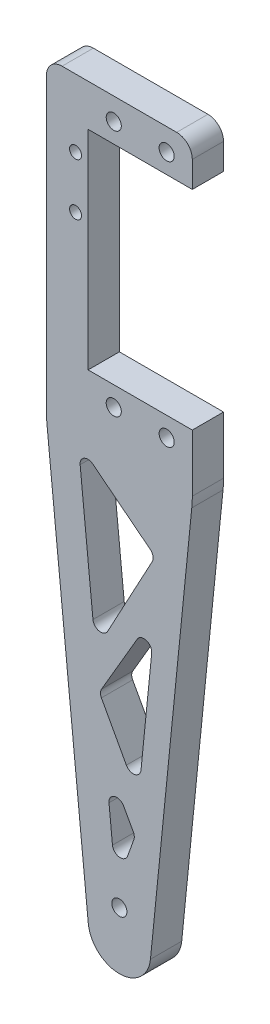
from build123d import *

# Parameters (mm, degrees)
BOSS_EXTRU_1_DEPTH      = 6
CONG_1_R                = 3
CONG_2_R                = 20
ENL_V_MAT_EXTRU_1_REACH = 118.402
ESQUISSE2_R             = 1.45
ENL_V_MAT_EXTRU_2_REACH = 118.402
CONG_3_R                = 1.5
ESQUISSE4_R             = 1.45
ENL_V_MAT_EXTRU_3_DEPTH = 6
ESQUISSE5_R             = 1.15
ENL_V_MAT_EXTRU_4_DEPTH = 6


with BuildPart() as part:
    # Esquisse1 → Boss.-Extru.1 (new body)
    with BuildSketch(Plane.XY):
        with BuildLine():
            Line((-14, -30), (-5.970001079, -110))
            ThreePointArc((-5.970001079, -110), (0, -115.400761222), (5.970001079, -110))
            Line((5.970001079, -110), (14, -30))
            Line((14, -30), (14, -18))
            Line((14, -18), (-6, -18))
            Line((-6, -18), (-6, 22))
            Line((-6, 22), (14, 22))
            Line((14, 22), (14, 30))
            Line((14, 30), (-14, 30))
            Line((-14, 30), (-14, -30))
        make_face()
    extrude(amount=BOSS_EXTRU_1_DEPTH)

    # Congé1
    cong_1_edges = [part.edges().sort_by_distance(p)[0] for p in [
        (-14, 30, 3),
        (14, 30, 3),
    ]]
    fillet(cong_1_edges, radius=CONG_1_R)

    # Congé2
    cong_2_edges = [part.edges().sort_by_distance(p)[0] for p in [
        (14, -30, 3),
        (-14, -30, 3),
    ]]
    fillet(cong_2_edges, radius=CONG_2_R)

    # Esquisse2 → Enlèv. mat.-Extru.1 (cut, up to next)
    with BuildSketch(Plane.XY.offset(6), mode=Mode.PRIVATE) as enl_v_mat_extru_1_sk1:
        with Locations((9.08, -21.75)):
            Circle(ESQUISSE2_R)
    enl_v_mat_extru_1_tool1 = extrude(enl_v_mat_extru_1_sk1.sketch, amount=-ENL_V_MAT_EXTRU_1_REACH, mode=Mode.PRIVATE) & part.part
    # Esquisse2 → Enlèv. mat.-Extru.1 (cut, up to next)
    with BuildSketch(Plane.XY.offset(6), mode=Mode.PRIVATE) as enl_v_mat_extru_1_sk2:
        with Locations((-1.08, -21.75)):
            Circle(ESQUISSE2_R)
    enl_v_mat_extru_1_tool2 = extrude(enl_v_mat_extru_1_sk2.sketch, amount=-ENL_V_MAT_EXTRU_1_REACH, mode=Mode.PRIVATE) & part.part
    # Esquisse2 → Enlèv. mat.-Extru.1 (cut, up to next)
    with BuildSketch(Plane.XY.offset(6), mode=Mode.PRIVATE) as enl_v_mat_extru_1_sk3:
        with Locations((-1.08, 25.75)):
            Circle(ESQUISSE2_R)
    enl_v_mat_extru_1_tool3 = extrude(enl_v_mat_extru_1_sk3.sketch, amount=-ENL_V_MAT_EXTRU_1_REACH, mode=Mode.PRIVATE) & part.part
    # Esquisse2 → Enlèv. mat.-Extru.1 (cut, up to next)
    with BuildSketch(Plane.XY.offset(6), mode=Mode.PRIVATE) as enl_v_mat_extru_1_sk4:
        with Locations((9.08, 25.75)):
            Circle(ESQUISSE2_R)
    enl_v_mat_extru_1_tool4 = extrude(enl_v_mat_extru_1_sk4.sketch, amount=-ENL_V_MAT_EXTRU_1_REACH, mode=Mode.PRIVATE) & part.part
    add(enl_v_mat_extru_1_tool1.solids().sort_by_distance((9.08, -21.75, 6))[0], mode=Mode.SUBTRACT)
    add(enl_v_mat_extru_1_tool2.solids().sort_by_distance((-1.08, -21.75, 6))[0], mode=Mode.SUBTRACT)
    add(enl_v_mat_extru_1_tool3.solids().sort_by_distance((-1.08, 25.75, 6))[0], mode=Mode.SUBTRACT)
    add(enl_v_mat_extru_1_tool4.solids().sort_by_distance((9.08, 25.75, 6))[0], mode=Mode.SUBTRACT)

    # Esquisse3 → Enlèv. mat.-Extru.2 (cut, up to next)
    with BuildSketch(Plane.XY.offset(6), mode=Mode.PRIVATE) as enl_v_mat_extru_2_sk1:
        Polygon((-7.886583597, -31.017533633), (-4.584381628, -63.916187805), (6.894740823, -42.63737417), align=None)
    enl_v_mat_extru_2_tool1 = extrude(enl_v_mat_extru_2_sk1.sketch, amount=-ENL_V_MAT_EXTRU_2_REACH, mode=Mode.PRIVATE) & part.part
    # Esquisse3 → Enlèv. mat.-Extru.2 (cut, up to next)
    with BuildSketch(Plane.XY.offset(6), mode=Mode.PRIVATE) as enl_v_mat_extru_2_sk2:
        Polygon((6.894740823, -52.121802831), (-3.854189345, -70.511493223), (3.66385974, -84.30991259), align=None)
    enl_v_mat_extru_2_tool2 = extrude(enl_v_mat_extru_2_sk2.sketch, amount=-ENL_V_MAT_EXTRU_2_REACH, mode=Mode.PRIVATE) & part.part
    # Esquisse3 → Enlèv. mat.-Extru.2 (cut, up to next)
    with BuildSketch(Plane.XY.offset(6), mode=Mode.PRIVATE) as enl_v_mat_extru_2_sk3:
        Polygon((-2.728137467, -80.682315655), (-0.663223344, -101.254314661), (3.006387716, -91.078168987), align=None)
    enl_v_mat_extru_2_tool3 = extrude(enl_v_mat_extru_2_sk3.sketch, amount=-ENL_V_MAT_EXTRU_2_REACH, mode=Mode.PRIVATE) & part.part
    add(enl_v_mat_extru_2_tool1.solids().sort_by_distance((-1.858741, -45.857032, 6))[0], mode=Mode.SUBTRACT)
    add(enl_v_mat_extru_2_tool2.solids().sort_by_distance((2.234804, -68.98107, 6))[0], mode=Mode.SUBTRACT)
    add(enl_v_mat_extru_2_tool3.solids().sort_by_distance((-0.128324, -91.004933, 6))[0], mode=Mode.SUBTRACT)

    # Congé3
    cong_3_edges = [part.edges().sort_by_distance(p)[0] for p in [
        (6.894740823, -42.63737417, 3),
        (-4.584381628, -63.916187805, 3),
        (-7.886583597, -31.017533633, 3),
        (3.006387716, -91.078168987, 3),
        (-2.728137467, -80.682315655, 3),
        (-0.663223344, -101.254314661, 3),
        (3.66385974, -84.30991259, 3),
        (-3.854189345, -70.511493223, 3),
        (6.894740823, -52.121802831, 3),
    ]]
    fillet(cong_3_edges, radius=CONG_3_R)

    # Esquisse4 → Enlèv. mat.-Extru.3 (cut)
    with BuildSketch(Plane.XY.offset(6)):
        with Locations((0, -104.400761222)):
            Circle(ESQUISSE4_R)
    extrude(amount=-ENL_V_MAT_EXTRU_3_DEPTH, mode=Mode.SUBTRACT)

    # Esquisse5 → Enlèv. mat.-Extru.4 (cut)
    with BuildSketch(Plane.XY.offset(6)):
        with Locations((-8.41, 17)):
            Circle(ESQUISSE5_R)
        with Locations((-8.41, 7)):
            Circle(ESQUISSE5_R)
    extrude(amount=-ENL_V_MAT_EXTRU_4_DEPTH, mode=Mode.SUBTRACT)


solid = part.part
